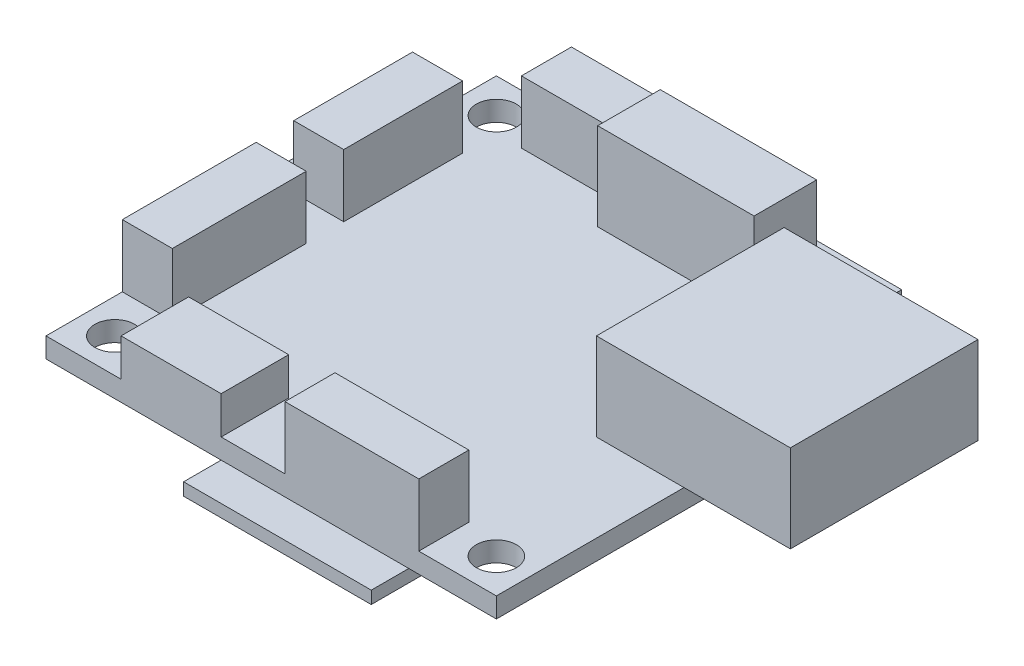
from build123d import *

# Parameters (mm, degrees)
SKETCH1_W                 = 36
SKETCH1_H                 = 36
SKETCH1_R                 = 1.6
BOSS_EXTRUDE1_DEPTH       = 1.6
SERVOCONNECTOR_DEPTH      = 8.5
SERVOCONNECTOR_DEPTH_BACK = 7
SKETCH2_W                 = 15
SKETCH2_H                 = 7
SDCARD_DEPTH              = 3
SDCARD_DEPTH_BACK         = 15
SKETCH3_W                 = 15
SKETCH3_H                 = 1
SKETCH4_W                 = 12.5
SKETCH4_H                 = 5
NC_DEPTH                  = 7
SKETCH5_W                 = 8
SKETCH5_H                 = 4
NC2_DEPTH                 = 5
SKETCH6_W                 = 4
SKETCH6_H                 = 9.5
SKETCH6_H_2               = 10.7
NC3_DEPTH                 = 5
SKETCH7_W                 = 8
SKETCH7_H                 = 5.4
MICROUSB_DEPTH            = 3
SKETCH7_3_W               = 10.7
SKETCH7_3_H               = 4
NC4_DEPTH                 = 5
SKETCH8_W                 = 4
SKETCH8_H                 = 11
GPS_AND_PITOT_DEPTH       = 5
SKETCH9_W                 = 10.4
SKETCH9_H                 = 4.7
CONNECTORGPSPITOT_DEPTH   = 4
SKETCH10_W                = 10
SKETCH10_H                = 4
NC5_DEPTH                 = 5
SKETCH10_3_W              = 11
SKETCH10_3_H              = 4
POWER_DEPTH               = 5
SKETCH11_W                = 10.4
SKETCH11_H                = 4.7
BOSS_EXTRUDE13_DEPTH      = 3


with BuildPart() as part:
    # Sketch1 → Boss-Extrude1 (new body)
    with BuildSketch(Plane(origin=(0, 0, 0), x_dir=(1, 0, 0), z_dir=(0, 1, 0))):
        Rectangle(SKETCH1_W, SKETCH1_H)
        with Locations((-15.25, 15.25)):
            Circle(SKETCH1_R, mode=Mode.SUBTRACT)
        with Locations((15.25, 15.25)):
            Circle(SKETCH1_R, mode=Mode.SUBTRACT)
        with Locations((15.25, -15.25)):
            Circle(SKETCH1_R, mode=Mode.SUBTRACT)
        with Locations((-15.25, -15.25)):
            Circle(SKETCH1_R, mode=Mode.SUBTRACT)
    extrude(amount=BOSS_EXTRUDE1_DEPTH)

    # Sketch2 → ServoConnector (add, two sides: drawn at the far end of the back side and taken through both)
    with BuildSketch(Plane(origin=(18, 0, 0), x_dir=(0, 0, -1), z_dir=(1, 0, 0)).offset(-SERVOCONNECTOR_DEPTH_BACK)):
        with Locations((4.5, 5.1)):
            Rectangle(SKETCH2_W, SKETCH2_H)
    extrude(amount=SERVOCONNECTOR_DEPTH + SERVOCONNECTOR_DEPTH_BACK)

    # Sketch3 → SDCard (add, two sides: drawn at the far end of the back side and taken through both)
    with BuildSketch(Plane.XY.offset(18).offset(-SDCARD_DEPTH_BACK)):
        with Locations((3.5, -0.5)):
            Rectangle(SKETCH3_W, SKETCH3_H)
    extrude(amount=SDCARD_DEPTH + SDCARD_DEPTH_BACK)

    # Sketch4 → NC (add)
    with BuildSketch(Plane(origin=(0, 1.6, 0), x_dir=(1, 0, 0), z_dir=(0, 1, 0))):
        with Locations((2.75, 14.1)):
            Rectangle(SKETCH4_W, SKETCH4_H)
    extrude(amount=NC_DEPTH)

    # Sketch5 → NC2 (add)
    with BuildSketch(Plane(origin=(0, 1.6, 0), x_dir=(1, 0, 0), z_dir=(0, 1, 0))):
        with Locations((-8, 16)):
            Rectangle(SKETCH5_W, SKETCH5_H)
    extrude(amount=NC2_DEPTH)

    # Sketch6 → NC3 (add)
    with BuildSketch(Plane(origin=(0, 1.6, 0), x_dir=(1, 0, 0), z_dir=(0, 1, 0))):
        with Locations((-16, 6.55)):
            Rectangle(SKETCH6_W, SKETCH6_H)
        with Locations((-16, -6.55)):
            Rectangle(SKETCH6_W, SKETCH6_H_2)
    extrude(amount=NC3_DEPTH)

    # Sketch7 → MicroUsb (add)
    with BuildSketch(Plane(origin=(0, 1.6, 0), x_dir=(1, 0, 0), z_dir=(0, 1, 0))):
        with Locations((-8, -15.3)):
            Rectangle(SKETCH7_W, SKETCH7_H)
    extrude(amount=MICROUSB_DEPTH)

    # Sketch7<3> → NC4 (add)
    with BuildSketch(Plane(origin=(0, 1.6, 0), x_dir=(1, 0, 0), z_dir=(0, 1, 0))):
        with Locations((6.45, -16)):
            Rectangle(SKETCH7_3_W, SKETCH7_3_H)
    extrude(amount=NC4_DEPTH)

    # Sketch8 → GPS and Pitot (add)
    with BuildSketch(Plane(origin=(0, 0, 0), x_dir=(-1, 0, 0), z_dir=(0, -1, 0))):
        with Locations((16, 6)):
            Rectangle(SKETCH8_W, SKETCH8_H)
    extrude(amount=GPS_AND_PITOT_DEPTH)

    # Sketch9 → ConnectorGPSPitot (add)
    with BuildSketch(Plane.ZY.offset(18)):
        with Locations((-6, -2.35)):
            Rectangle(SKETCH9_W, SKETCH9_H)
    extrude(amount=CONNECTORGPSPITOT_DEPTH)

    # Sketch10 → NC5 (add)
    with BuildSketch(Plane.XZ):
        with Locations((-7.6, -16)):
            Rectangle(SKETCH10_W, SKETCH10_H)
    extrude(amount=NC5_DEPTH)

    # Sketch10<3> → Power (add)
    with BuildSketch(Plane.XZ):
        with Locations((6.2, -16)):
            Rectangle(SKETCH10_3_W, SKETCH10_3_H)
    extrude(amount=POWER_DEPTH)

    # Sketch11 → Boss-Extrude13 (add)
    with BuildSketch(Plane(origin=(0, 0, -18), x_dir=(-1, 0, 0), z_dir=(0, 0, -1))):
        with Locations((-6.2, -2.35)):
            Rectangle(SKETCH11_W, SKETCH11_H)
    extrude(amount=BOSS_EXTRUDE13_DEPTH)


solid = part.part
